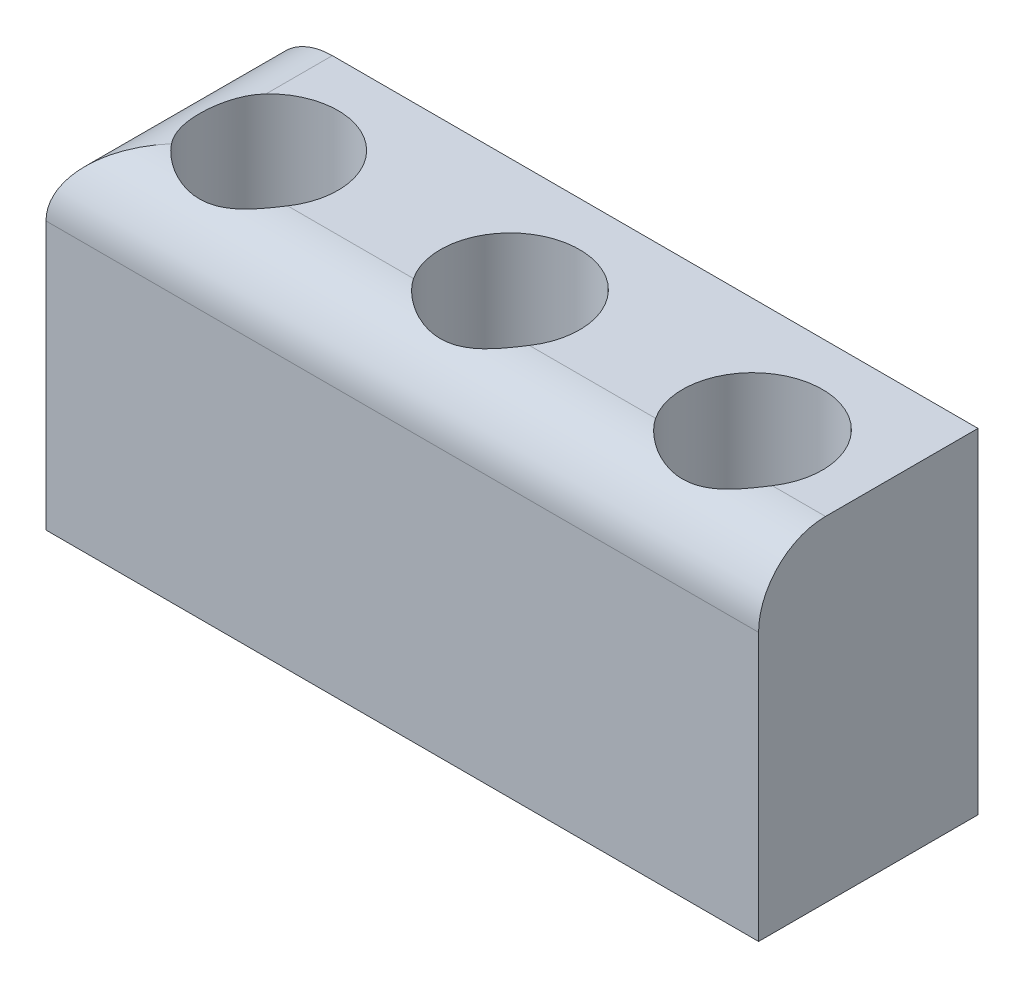
from build123d import *

# Parameters (mm, degrees)
SKETCH1_W           = 21.293186277
SKETCH1_H           = 6.556248908
SKETCH1_R           = 2.09
SKETCH1_R_2         = 2.07
SKETCH1_R_3         = 2.08
BOSS_EXTRUDE1_DEPTH = 10
FILLET1_R           = 2


with BuildPart() as part:
    # Sketch1 → Boss-Extrude1 (new body)
    with BuildSketch(Plane(origin=(0, 0, 0), x_dir=(1, 0, 0), z_dir=(0, 1, 0))):
        with Locations((10.646593139, 3.278124454)):
            Rectangle(SKETCH1_W, SKETCH1_H)
        with Locations(Location((17.959518774, 3.152151811, 0), (0, 0, 270))):
            Circle(SKETCH1_R, mode=Mode.SUBTRACT)
        with Locations(Location((3.502477391, 3.152151811, 0), (0, 0, 270))):
            Circle(SKETCH1_R_2, mode=Mode.SUBTRACT)
        with Locations(Location((10.712545691, 3.152151811, 0), (0, 0, 270))):
            Circle(SKETCH1_R_3, mode=Mode.SUBTRACT)
    extrude(amount=BOSS_EXTRUDE1_DEPTH)

    # Fillet1
    # the kernel refuses this fillet: 2 mm, written as the material it takes off along each edge
    with BuildSketch(Plane(origin=(-5, 10, 0), x_dir=(0, -1, 0), z_dir=(1, 0, 0))) as fillet1_piece_1:
        with BuildLine():
            CenterArc((FILLET1_R, FILLET1_R), FILLET1_R, 180, 90)
            Line((0, FILLET1_R), (0, 0))
            Line((0, 0), (FILLET1_R, 0))
        make_face()
    extrude(amount=31.293186277, mode=Mode.SUBTRACT)
    with BuildSketch(Plane(origin=(0, 10, -11.556248908), x_dir=(0, -1, 0), z_dir=(0, 0, 1))) as fillet1_piece_2:
        with BuildLine():
            CenterArc((FILLET1_R, FILLET1_R), FILLET1_R, 180, 90)
            Line((0, FILLET1_R), (0, 0))
            Line((0, 0), (FILLET1_R, 0))
        make_face()
    extrude(amount=16.556248908, mode=Mode.SUBTRACT)


solid = part.part
